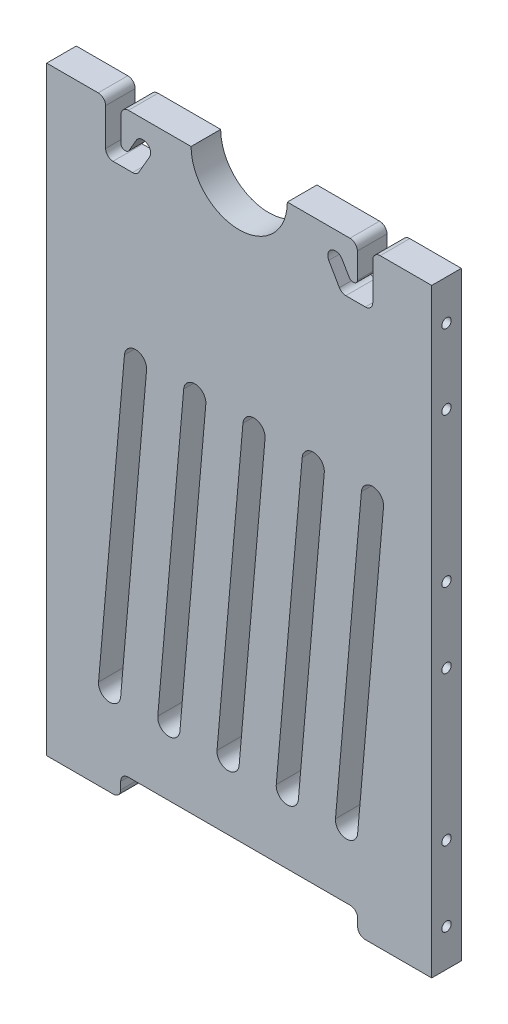
from build123d import *

# Parameters (mm, degrees)
SKETCH1_W                       = 165.1
SKETCH1_H                       = 12.7
BOSS_EXTRUDE1_DEPTH             = 128.5875
SKETCH2_R                       = 20.6375
CUT_EXTRUDE1_DEPTH              = 154.33146336
CUT_EXTRUDE3_DEPTH              = 154.33146336
FILLET1_R                       = 3.175
FILLET2_R                       = 1.5875
SKETCH5_W                       = 101.6
SKETCH5_H                       = 9.525
CUT_EXTRUDE4_DEPTH              = 154.33146336
FILLET3_R                       = 3.175
F_21_0_159_DIAMETER_HOLE2_D     = 4.0386
F_21_0_159_DIAMETER_HOLE2_DEPTH = 20.6375
F_21_0_159_DIAMETER_HOLE2_TIP   = 1.213317848
CUT_EXTRUDE5_DEPTH              = 154.33146336


# Read off the part's stored shape, not the designer's step: #21 (0.159) Diameter Hole1
with BuildPart() as part:
    # Sketch1 → Boss-Extrude1 (new, symmetric)
    with BuildSketch(Plane(origin=(0, 0, 0), x_dir=(1, 0, 0), z_dir=(0, 1, 0))):
        Rectangle(SKETCH1_W, SKETCH1_H)
    extrude(amount=BOSS_EXTRUDE1_DEPTH, both=True)

    # Sketch2 → Cut-Extrude1 (cut, through all)
    with BuildSketch(Plane.XY.offset(6.35)):
        with Locations((0, 128.5875)):
            Circle(SKETCH2_R)
    extrude(amount=-CUT_EXTRUDE1_DEPTH, mode=Mode.SUBTRACT)

    # Sketch4 → Cut-Extrude3 (cut, through all)
    with BuildSketch(Plane.XY.offset(6.35)):
        with BuildLine():
            Line((57.277, 128.5875), (57.277, 106.3625))
            Line((57.277, 106.3625), (43.877983689, 106.3625))
            Line((43.877983689, 106.3625), (38.415384653, 115.823999072))
            ThreePointArc((38.415384653, 115.823999072), (39.623999536, 120.334615615), (44.134615883, 119.126))
            Line((44.134615883, 119.126), (47.690804866, 112.9665))
            Line((47.690804866, 112.9665), (50.673, 112.9665))
            Line((50.673, 112.9665), (50.673, 128.5875))
            Line((50.673, 128.5875), (57.277, 128.5875))
        make_face()
        with BuildLine():
            Line((-50.673, 128.5875), (-57.277, 128.5875))
            Line((-57.277, 128.5875), (-57.277, 106.3625))
            Line((-57.277, 106.3625), (-43.877983689, 106.3625))
            Line((-43.877983689, 106.3625), (-38.415384653, 115.823999072))
            ThreePointArc((-38.415384653, 115.823999072), (-39.623999536, 120.334615615), (-44.134615883, 119.126))
            Line((-44.134615883, 119.126), (-47.690804866, 112.9665))
            Line((-47.690804866, 112.9665), (-50.673, 112.9665))
            Line((-50.673, 112.9665), (-50.673, 128.5875))
        make_face()
    extrude(amount=-CUT_EXTRUDE3_DEPTH, mode=Mode.SUBTRACT)

    # Fillet1
    fillet1_edges = [part.edges().sort_by_distance(p)[0] for p in [
        (50.673, 128.5875, 0),
        (57.277, 128.5875, 0),
        (57.277, 106.3625, 0),
        (43.877983689, 106.3625, 0),
        (-43.877983689, 106.3625, 0),
        (-57.277, 106.3625, 0),
        (-57.277, 128.5875, 0),
        (-50.673, 128.5875, 0),
    ]]
    fillet(fillet1_edges, radius=FILLET1_R)

    # Fillet2
    fillet2_edges = [part.edges().sort_by_distance(p)[0] for p in [
        (47.690804866, 112.9665, 0),
        (50.673, 112.9665, 0),
        (-50.673, 112.9665, 0),
        (-47.690804866, 112.9665, 0),
    ]]
    fillet(fillet2_edges, radius=FILLET2_R)

    # Sketch5 → Cut-Extrude4 (cut, through all)
    with BuildSketch(Plane.XY.offset(6.35)):
        with Locations((0, -123.825)):
            Rectangle(SKETCH5_W, SKETCH5_H)
    extrude(amount=-CUT_EXTRUDE4_DEPTH, mode=Mode.SUBTRACT)

    # Fillet3
    fillet3_edges = [part.edges().sort_by_distance(p)[0] for p in [
        (-50.8, -128.5875, 0),
        (-50.8, -119.0625, 0),
        (50.8, -119.0625, 0),
        (50.8, -128.5875, 0),
    ]]
    fillet(fillet3_edges, radius=FILLET3_R)

    # #21 (0.159) Diameter Hole1 outline → #21 (0.159) Diameter Hole1 (revolve, cut)
    with BuildSketch(Plane(origin=(0, 111.412500004, 0), x_dir=(0, 1, 0), z_dir=(0, 0, -1))):
        Polygon((0, 82.55), (0, 60.699182152), (2.0193, 61.9125), (2.0193, 82.55), align=None)
    revolve(axis=Axis((0, 111.412500004, 0), (1, 0, 0)), mode=Mode.SUBTRACT)

    # 21 _0.159_ Diameter Hole1 2 outline → 21 _0.159_ Diameter Hole1 2 (revolve, cut)
    with BuildSketch(Plane(origin=(0, 79.412500004, 0), x_dir=(0, 1, 0), z_dir=(0, 0, -1))):
        Polygon((0, 82.55), (0, 60.699182152), (2.0193, 61.9125), (2.0193, 82.55), align=None)
    revolve(axis=Axis((0, 79.412500004, 0), (1, 0, 0)), mode=Mode.SUBTRACT)

    # 21 _0.159_ Diameter Hole1 3 outline → 21 _0.159_ Diameter Hole1 3 (revolve, cut)
    with BuildSketch(Plane(origin=(0, 15.412500004, 0), x_dir=(0, 1, 0), z_dir=(0, 0, -1))):
        Polygon((0, 82.55), (0, 60.699182152), (2.0193, 61.9125), (2.0193, 82.55), align=None)
    revolve(axis=Axis((0, 15.412500004, 0), (1, 0, 0)), mode=Mode.SUBTRACT)

    # 21 _0.159_ Diameter Hole1 4 outline → 21 _0.159_ Diameter Hole1 4 (revolve, cut)
    with BuildSketch(Plane(origin=(0, -16.587499996, 0), x_dir=(0, 1, 0), z_dir=(0, 0, -1))):
        Polygon((0, 82.55), (0, 60.699182152), (2.0193, 61.9125), (2.0193, 82.55), align=None)
    revolve(axis=Axis((0, -16.587499996, 0), (1, 0, 0)), mode=Mode.SUBTRACT)

    # 21 _0.159_ Diameter Hole1 5 outline → 21 _0.159_ Diameter Hole1 5 (revolve, cut)
    with BuildSketch(Plane(origin=(0, -80.587499996, 0), x_dir=(0, 1, 0), z_dir=(0, 0, -1))):
        Polygon((0, 82.55), (0, 60.699182152), (2.0193, 61.9125), (2.0193, 82.55), align=None)
    revolve(axis=Axis((0, -80.587499996, 0), (1, 0, 0)), mode=Mode.SUBTRACT)

    # 21 _0.159_ Diameter Hole1 6 outline → 21 _0.159_ Diameter Hole1 6 (revolve, cut)
    with BuildSketch(Plane(origin=(0, -112.587499996, 0), x_dir=(0, 1, 0), z_dir=(0, 0, -1))):
        Polygon((0, 82.55), (0, 60.699182152), (2.0193, 61.9125), (2.0193, 82.55), align=None)
    revolve(axis=Axis((0, -112.587499996, 0), (1, 0, 0)), mode=Mode.SUBTRACT)

    # #21 (0.159) Diameter Hole2
    with Locations(Plane.ZY.offset(82.55)):
        with Locations((0, -112.587499996), (0, -80.587499996), (0, -16.587499996), (0, 15.412500004), (0, 79.412500004), (0, 111.412500004)):
            Hole(F_21_0_159_DIAMETER_HOLE2_D / 2, depth=F_21_0_159_DIAMETER_HOLE2_DEPTH)
            with Locations((0, 0, -(F_21_0_159_DIAMETER_HOLE2_DEPTH + F_21_0_159_DIAMETER_HOLE2_TIP / 2))):  # 118° drill point
                Cone(0, F_21_0_159_DIAMETER_HOLE2_D / 2, F_21_0_159_DIAMETER_HOLE2_TIP, mode=Mode.SUBTRACT)

    # Sketch10 → Cut-Extrude5 (cut, through all)
    with BuildSketch(Plane.XY.offset(6.35)):
        with BuildLine():
            Line((-60.30687725, -90.072420775), (-49.195816982, 36.927579225))
            ThreePointArc((-49.195816982, 36.927579225), (-44.036360507, 41.25687725), (-39.707062483, 36.097420775))
            Line((-39.707062483, 36.097420775), (-50.81812275, -90.902579225))
            ThreePointArc((-50.81812275, -90.902579225), (-55.977579225, -95.23187725), (-60.30687725, -90.072420775))
        make_face()
        with BuildLine():
            Line((-25.41812275, -90.902579225), (-14.307062483, 36.097420775))
            ThreePointArc((-14.307062483, 36.097420775), (-18.636360507, 41.25687725), (-23.795816982, 36.927579225))
            Line((-23.795816982, 36.927579225), (-34.90687725, -90.072420775))
            ThreePointArc((-34.90687725, -90.072420775), (-30.577579225, -95.23187725), (-25.41812275, -90.902579225))
        make_face()
        with BuildLine():
            Line((-0.01812275, -90.902579225), (11.092937517, 36.097420775))
            ThreePointArc((11.092937517, 36.097420775), (6.763639493, 41.25687725), (1.604183018, 36.927579225))
            Line((1.604183018, 36.927579225), (-9.50687725, -90.072420775))
            ThreePointArc((-9.50687725, -90.072420775), (-5.177579225, -95.23187725), (-0.01812275, -90.902579225))
        make_face()
        with BuildLine():
            Line((25.38187725, -90.902579225), (36.492937517, 36.097420775))
            ThreePointArc((36.492937517, 36.097420775), (32.163639493, 41.25687725), (27.004183018, 36.927579225))
            Line((27.004183018, 36.927579225), (15.89312275, -90.072420775))
            ThreePointArc((15.89312275, -90.072420775), (20.222420775, -95.23187725), (25.38187725, -90.902579225))
        make_face()
        with BuildLine():
            Line((50.78187725, -90.902579225), (61.892937517, 36.097420775))
            ThreePointArc((61.892937517, 36.097420775), (57.563639493, 41.25687725), (52.404183018, 36.927579225))
            Line((52.404183018, 36.927579225), (41.29312275, -90.072420775))
            ThreePointArc((41.29312275, -90.072420775), (45.622420775, -95.23187725), (50.78187725, -90.902579225))
        make_face()
    extrude(amount=-CUT_EXTRUDE5_DEPTH, mode=Mode.SUBTRACT)


solid = part.part
